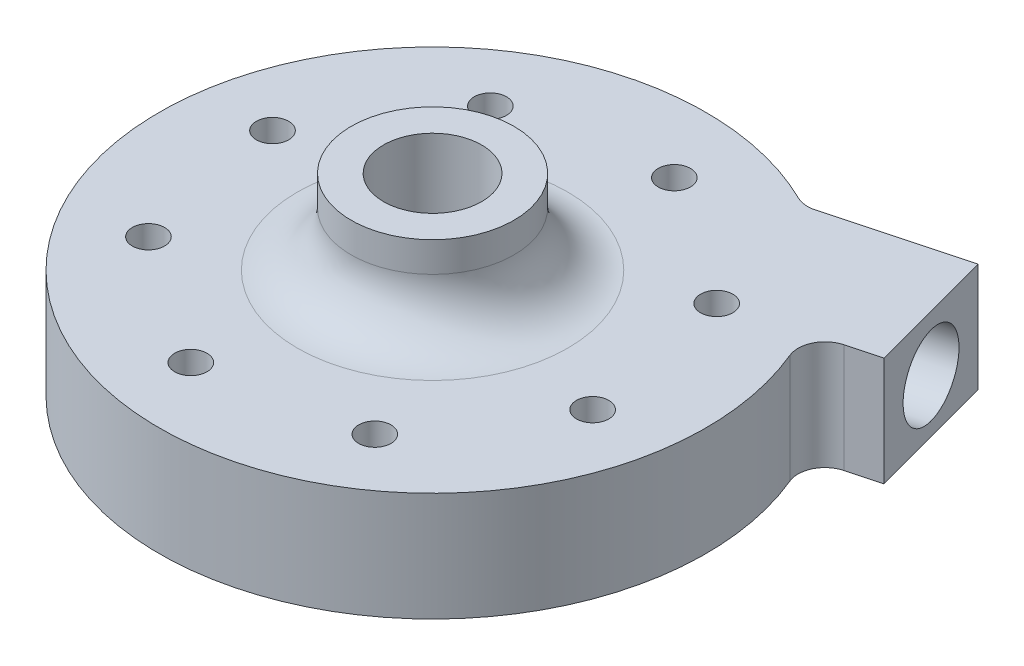
from build123d import *

# Parameters (mm, degrees)
SKETCH1_R            = 101.6
BODY_EXTRUSION_DEPTH = 50.8
SKETCH7_R            = 9.128125
INLET_TAP_DEPTH      = 20
SKETCH6_R            = 5.4102
DE_DEPTH             = 100
SKETCH18_R           = 152.4
TOP_PROFILE_DEPTH    = 76.2
SKETCH19_R           = 7.3421875
OUTLET_TAP_DEPTH     = 12
SKETCH20_R           = 3
BOLTS_DEPTH          = 76.2
BOLT_PATTERN_COUNT   = 8
FILLET1_R            = 10


with BuildPart() as part:
    # Sketch1 → body extrusion (new body)
    with BuildSketch(Plane(origin=(0, 0, 0), x_dir=(1, 0, 0), z_dir=(0, 1, 0))):
        Circle(SKETCH1_R)
    extrude(amount=BODY_EXTRUSION_DEPTH)

    # Sketch7 → inlet tap (cut)
    with BuildSketch(Plane(origin=(0, 50.8, 0), x_dir=(1, 0, 0), z_dir=(0, 1, 0))):
        Circle(SKETCH7_R)
    extrude(amount=-INLET_TAP_DEPTH, mode=Mode.SUBTRACT)

    # Sketch6 → De (cut)
    with BuildSketch(Plane(origin=(0, 50.8, 0), x_dir=(1, 0, 0), z_dir=(0, 1, 0))):
        Circle(SKETCH6_R)
    extrude(amount=-DE_DEPTH, mode=Mode.SUBTRACT)

    # Sketch2 → main chamber (revolve, cut)
    with BuildSketch(Plane.XY):
        Polygon((0, 19.970473788), (0, 26.8), (5.4102, 26.8), (27.1319, 26.780473788), (27.1319, 19.970473788), (27.1319, 0), (0, 0), align=None)
    revolve(axis=Axis((0, 19.970473788, 0), (0, 1, 0)), mode=Mode.SUBTRACT)

    # Sketch11 → conical outlet (revolve, cut)
    with BuildSketch(Plane(origin=(-6.384797532, 0, -23.828388787), x_dir=(0.9659258262890693, 0, -0.2588190451025173), z_dir=(0.2588190451025173, 0, 0.9659258262890693))):
        Polygon((6.610028802, 26.370571699), (106.229498611, 35.086145974), (106.229498611, 24.875473788), (6.610028802, 24.875473788), align=None)
    revolve(axis=Axis((0, 24.875473788, -25.539190129), (0.9659258262890692, 0, -0.2588190451025173)), mode=Mode.SUBTRACT)

    # Sketch18 → top profile (cut)
    with BuildSketch(Plane(origin=(0, 50.8, 0), x_dir=(1, 0, 0), z_dir=(0, 1, 0))):
        Circle(SKETCH18_R)
        with BuildLine():
            Line((49.724048628, 51.640281537), (25.894140427, 45.255076878))
            ThreePointArc((25.894140427, 45.255076878), (24.113918505, 45.108394039), (22.395740076, 45.596829127))
            ThreePointArc((22.395740076, 45.596829127), (-37.035813836, -34.770511839), (46.917809265, 19.477144908))
            ThreePointArc((46.917809265, 19.477144908), (47.050472758, 23.603870372), (50.241608652, 26.223815861))
            Line((50.241608652, 26.223815861), (56.112834995, 27.797006218))
            Line((56.112834995, 27.797006218), (49.724048628, 51.640281537))
        make_face(mode=Mode.SUBTRACT)
    extrude(amount=-TOP_PROFILE_DEPTH, mode=Mode.SUBTRACT)

    # Sketch19 → outlet tap (cut)
    with BuildSketch(Plane(origin=(59.303239344, 0, -15.890255091), x_dir=(-0.258819045102518, 0, -0.9659258262890691), z_dir=(0.9659258262890691, 0, -0.258819045102518))):
        with Locations((24.668963328, 24.875473788)):
            Circle(SKETCH19_R)
    extrude(amount=-OUTLET_TAP_DEPTH, mode=Mode.SUBTRACT)

    # Sketch14 → upper lower cuts (revolve, cut)
    with BuildSketch(Plane.XY):
        Polygon((15.128125, 50.8), (15.128125, 35.217661288), (50.8, 35.217661288), (127, 35.217661288), (127, 50.8), (50.8, 50.8), align=None)
        Polygon((0, 0), (0, 14.970473788), (50.8, 14.970473788), (127, 14.970473788), (127, 0), (50.8, 0), align=None)
    revolve(axis=Axis((0, 0, 0), (0, 1, 0)), mode=Mode.SUBTRACT)

    # Sketch20 → bolts (cut)
    with BuildSketch(Plane(origin=(0, 35.217661288, 0), x_dir=(1, 0, 0), z_dir=(0, 1, 0))):
        with Locations((7.590653477, 37.336202)):
            Circle(SKETCH20_R)
    bolts = extrude(amount=-BOLTS_DEPTH, mode=Mode.SUBTRACT)

    # bolt pattern: bolts ×8 about axis
    bolt_pattern_axis = Axis((0, 35.217661288, 0), (0, 1, 0))
    for i in range(1, BOLT_PATTERN_COUNT):
        add(bolts.rotate(bolt_pattern_axis, i * 360 / BOLT_PATTERN_COUNT), mode=Mode.SUBTRACT)

    # Fillet1
    fillet1_edges = [part.edges().sort_by_distance(p)[0] for p in [
        (-15.128125, 35.217661288, 0),
    ]]
    fillet(fillet1_edges, radius=FILLET1_R)


solid = part.part
